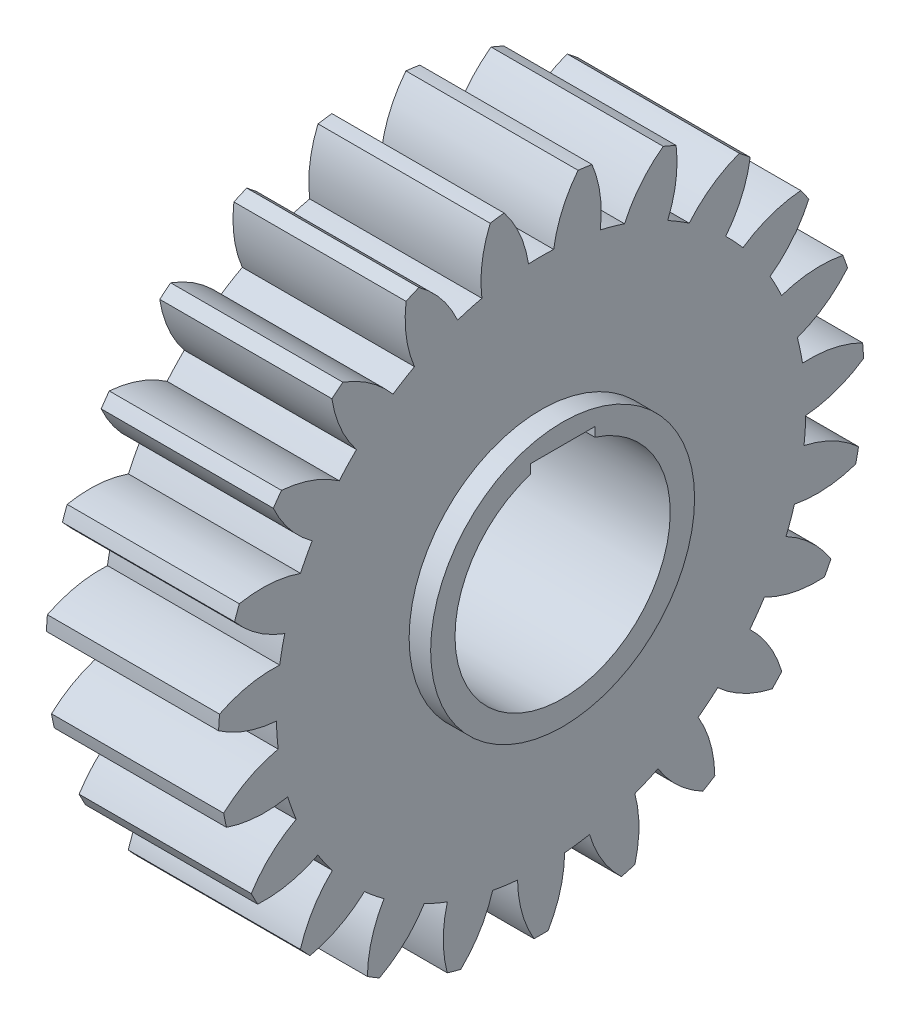
from build123d import *

# Parameters (mm, degrees)
BASPROSKE_W         = 4
BASPROSKE_H         = 7.5
TOOTHCUT_DEPTH      = 12.335784049
TEETHCUTS_COUNT     = 23
TEETHCUTS_ANGLE     = 344.347826087
BORSKE_R            = 2.5
BORE_DEPTH          = 50.0000508
EXTRUDE1_DEPTH      = 0.5
EXTRUDE1_DEPTH_BACK = 4.5
SKETCH1_R           = 3.065937152
SKETCH1_R_2         = 2.5
SKETCH2_W           = 1.5
SKETCH2_H           = 2.6
CUT_EXTRUDE1_DEPTH  = 5.5


with BuildPart() as part:
    # BasProSke → Base-Revolve (revolve)
    with BuildSketch(Plane(origin=(0, 0, 0), x_dir=(1, 0, 0), z_dir=(0, 1, 0))):
        with Locations((2, 3.75)):
            Rectangle(BASPROSKE_W, BASPROSKE_H)
    revolve(axis=Axis((-10, 0, 0), (1, 0, 0)))

    # TooCutSke → ToothCut (cut, through all)
    with BuildSketch(Plane(origin=(0, 0, 0), x_dir=(0, 0, -1), z_dir=(1, 0, 0))):
        with BuildLine():
            ThreePointArc((0.292498096, 6.142039227), (0, 6.149), (-0.292498096, 6.142039227))
            ThreePointArc((-0.292498096, 6.142039227), (-0.495998432, 6.847302274), (-0.878204189, 7.473981707))
            ThreePointArc((-0.878204189, 7.473981707), (0, 7.5254), (0.878204189, 7.473981707))
            ThreePointArc((0.878204189, 7.473981707), (0.495998432, 6.847302274), (0.292498096, 6.142039227))
        make_face()
    toothcut = extrude(amount=TOOTHCUT_DEPTH, mode=Mode.SUBTRACT)

    # TeethCuts: ToothCut ×23 about axis
    teethcuts_axis = Axis((-10, 0, 0), (1, 0, 0))
    for i in range(1, TEETHCUTS_COUNT):
        add(toothcut.rotate(teethcuts_axis, i * TEETHCUTS_ANGLE / (TEETHCUTS_COUNT - 1)), mode=Mode.SUBTRACT)

    # BorSke → Bore (cut, symmetric)
    with BuildSketch(Plane(origin=(0, 0, 0), x_dir=(0, 0, -1), z_dir=(1, 0, 0))):
        Circle(BORSKE_R)
    extrude(amount=BORE_DEPTH, both=True, mode=Mode.SUBTRACT)

    # Sketch1 → Extrude1 (add, two sides: drawn at the far end of the back side and taken through both)
    with BuildSketch(Plane(origin=(4, 0, 0), x_dir=(0, 0, -1), z_dir=(1, 0, 0)).offset(-EXTRUDE1_DEPTH_BACK)):
        Circle(SKETCH1_R)
        Circle(SKETCH1_R_2, mode=Mode.SUBTRACT)
    extrude(amount=EXTRUDE1_DEPTH + EXTRUDE1_DEPTH_BACK)

    # Sketch2 → Cut-Extrude1 (cut)
    with BuildSketch(Plane(origin=(4.5, 0, 0), x_dir=(0, 0, -1), z_dir=(1, 0, 0))):
        with Locations((0, 1.3)):
            Rectangle(SKETCH2_W, SKETCH2_H)
    extrude(amount=-CUT_EXTRUDE1_DEPTH, mode=Mode.SUBTRACT)


solid = part.part
